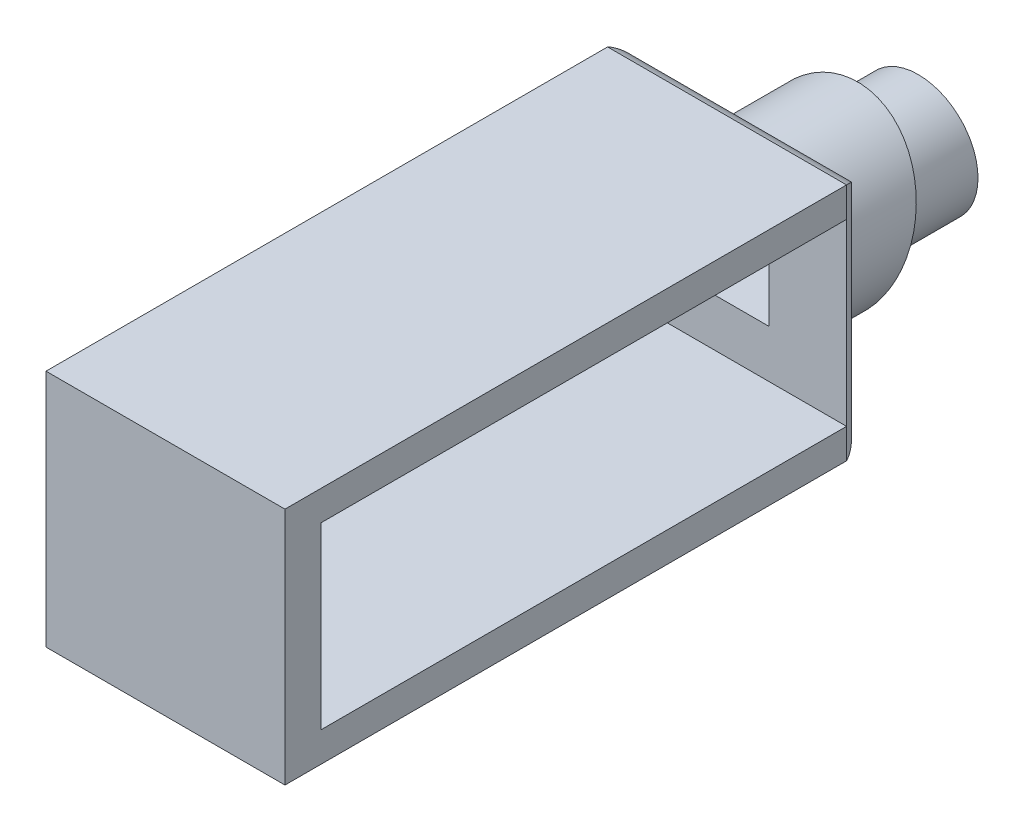
from build123d import *

# Parameters (mm, degrees)
CROQUIS1_R              = 2.5
CROQUIS1_R_2            = 1.8
SALIENTE_EXTRUIR1_DEPTH = 7
SALIENTE_EXTRUIR2_REACH = 9.842
CROQUIS3_R              = 3.5
CROQUIS3_R_2            = 1.6
CROQUIS4_W              = 10
CROQUIS4_H              = 10
SALIENTE_EXTRUIR3_DEPTH = 1
REDONDEO2_R             = 1.5
CROQUIS7_W              = 3.5
CROQUIS7_H              = 3.5
CORTAR_EXTRUIR1_DEPTH   = 3
SALIENTE_EXTRUIR4_DEPTH = 22
CROQUIS9_W              = 10
CROQUIS9_H              = 10
SALIENTE_EXTRUIR5_DEPTH = 1.5


with BuildPart() as part:
    # Croquis1 → Saliente-Extruir1 (new body)
    with BuildSketch(Plane.XY):
        Circle(CROQUIS1_R)
        Circle(CROQUIS1_R_2, mode=Mode.SUBTRACT)
    extrude(amount=SALIENTE_EXTRUIR1_DEPTH)

    # Saliente-Extruir2: up to this plane
    saliente_extruir2_end = Plane(origin=(0, 1.223696204, 3.362077689), z_dir=(0, -0.34202014332567576, -0.9396926207859059))
    # Croquis3 → Saliente-Extruir2 (add, up to the surface)
    with BuildSketch(Plane.XY.offset(7), mode=Mode.PRIVATE) as saliente_extruir2_sk1:
        Circle(CROQUIS3_R)
        Circle(CROQUIS3_R_2, mode=Mode.SUBTRACT)
    saliente_extruir2_tool1 = split(extrude(saliente_extruir2_sk1.sketch, amount=-SALIENTE_EXTRUIR2_REACH, mode=Mode.PRIVATE), bisect_by=saliente_extruir2_end, keep=Keep.BOTH, mode=Mode.PRIVATE)
    add(saliente_extruir2_tool1.solids().sort_by_distance((-3.401005, 0, 7))[0])

    # Croquis4 → Saliente-Extruir3 (add)
    with BuildSketch(Plane.XY.offset(7)):
        Rectangle(CROQUIS4_W, CROQUIS4_H)
    extrude(amount=SALIENTE_EXTRUIR3_DEPTH)

    # Redondeo2
    # the kernel refuses this fillet: 1.5 mm, written as the material it takes off along each edge
    with BuildSketch(Plane(origin=(-5, -8.535533906, 7), x_dir=(0, 0, 1), z_dir=(0, 1, 0)), Plane(origin=(8.535533906, -5, 7), x_dir=(0, 0, 1), z_dir=(-1, 0, 0)), Plane(origin=(5, 8.535533906, 7), x_dir=(0, 0, 1), z_dir=(0, -1, 0))) as redondeo2_piece_1:
        with BuildLine():
            CenterArc((1.5, 1.414213562), REDONDEO2_R, 180, 70.528779366)
            Line((0, 1.414213562), (-0.03, 1.414213562))
            Line((-0.03, 1.414213562), (-0.03, 0))
            Line((-0.03, 0), (0, -0.03))
            ThreePointArc((0, -0.03), (0.5, -0.03), (0.99, -0.028284271))
            Line((0.99, -0.028284271), (1, 0))
        make_face()
    extrude(amount=17.071067812, mode=Mode.SUBTRACT)
    with BuildSketch(Plane(origin=(-8.535533906, 5, 7), x_dir=(0, -1, 0), z_dir=(1, 0, 0))) as redondeo2_piece_2:
        with BuildLine():
            CenterArc((1.414213562, -1.5), REDONDEO2_R, 90, 70.528779366)
            Line((0, -1), (-0.028284271, -0.99))
            ThreePointArc((-0.028284271, -0.99), (-0.03, -0.5), (-0.03, 0))
            Line((-0.03, 0), (0, 0.03))
            Line((0, 0.03), (1.414213562, 0.03))
            Line((1.414213562, 0.03), (1.414213562, 0))
        make_face()
    extrude(amount=17.071067812, mode=Mode.SUBTRACT)

    # Croquis7 → Cortar-Extruir1 (cut)
    with BuildSketch(Plane.XY.offset(8)):
        Rectangle(CROQUIS7_W, CROQUIS7_H)
    extrude(amount=-CORTAR_EXTRUIR1_DEPTH, mode=Mode.SUBTRACT)

    # Croquis8 → Saliente-Extruir4 (add)
    with BuildSketch(Plane.XY.offset(8)):
        Polygon((3.75, 5), (-5, 5), (-5, -5), (3.75, -5), (5, -5), (5, -3.75), (3.75, -3.75), (-3.75, -3.75), (-3.75, 3.75), (3.75, 3.75), (5, 3.75), (5, 5), align=None)
    extrude(amount=SALIENTE_EXTRUIR4_DEPTH)

    # Croquis9 → Saliente-Extruir5 (add)
    with BuildSketch(Plane.XY.offset(30)):
        Rectangle(CROQUIS9_W, CROQUIS9_H)
    extrude(amount=SALIENTE_EXTRUIR5_DEPTH)


solid = part.part
